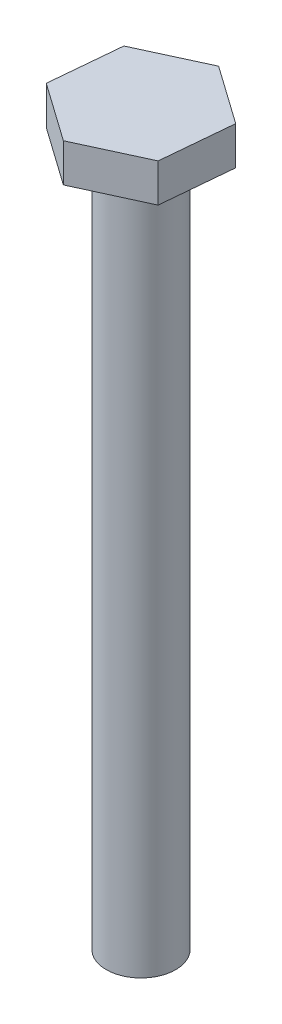
from build123d import *

# Parameters (mm, degrees)
SKETCH2_R           = 6.35
BOSS_EXTRUDE1_DEPTH = 127
BOSS_EXTRUDE2_DEPTH = 7


with BuildPart() as part:
    # Sketch2 → Boss-Extrude1 (new body)
    with BuildSketch(Plane(origin=(0, 0, 0), x_dir=(1, 0, 0), z_dir=(0, 1, 0))):
        Circle(SKETCH2_R)
    extrude(amount=-BOSS_EXTRUDE1_DEPTH)

    # Sketch3 → Boss-Extrude2 (add)
    with BuildSketch(Plane(origin=(0, 0, 0), x_dir=(1, 0, 0), z_dir=(0, 1, 0))):
        Polygon((10.661729582, -7.533342667), (11.854930916, 5.466657333), (1.193201334, 13), (-10.661729582, 7.533342667), (-11.854930916, -5.466657333), (-1.193201334, -13), align=None)
    extrude(amount=BOSS_EXTRUDE2_DEPTH)


solid = part.part
